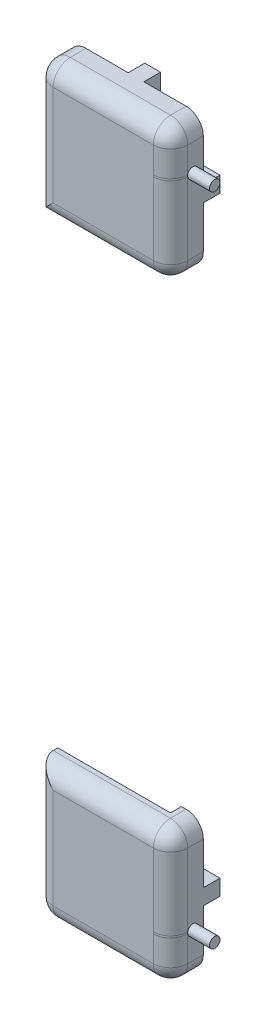
from build123d import *

# Parameters (mm, degrees)
SKETCH6_W              = 32.730904613
SKETCH6_H              = 32.73
LID_EXTRUSION_DEPTH    = 6.35
LEG_EXTRUSION_DEPTH    = 9.53
SKETCH8_W              = 4.572
SKETCH8_H              = 6.35
LOCKING_PIN_DEPTH      = 4.826
SKETCH9_R              = 1.524
LOCKING_CYLINDER_DEPTH = 6.35
FILLET2_R              = 5
FILLET3_R              = 5


# Read off the part's stored shape, not the designer's step: Leg Extrusion
with BuildPart() as part:
    # Sketch6 → Lid Extrusion (new body)
    with BuildSketch(Plane.XY.offset(83.495959084)):
        with Locations((-144.040218944, -497.625165889)):
            Rectangle(SKETCH6_W, SKETCH6_H)
    extrude(amount=LID_EXTRUSION_DEPTH)

    # Leg Extrusion outline → Leg Extrusion (add)
    with BuildSketch(Plane.XY.offset(80.315959084)):
        with BuildLine():
            Line((-160.405671251, -513.990165889), (-160.405671251, -520.340165889))
            Line((-160.405671251, -520.340165889), (-121.324766638, -520.340165889))
            Line((-121.324766638, -520.340165889), (-121.324766638, -486.260165889))
            ThreePointArc((-121.324766638, -486.260165889), (-122.789232732, -482.724631983), (-126.324766638, -481.260165889))
            Line((-126.324766638, -481.260165889), (-127.674766638, -481.260165889))
            Line((-127.674766638, -481.260165889), (-127.674766638, -513.990165889))
            Line((-127.674766638, -513.990165889), (-160.405671251, -513.990165889))
        make_face()
    extrude(amount=LEG_EXTRUSION_DEPTH)

    # Sketch8 → Locking Pin (add)
    with BuildSketch(Plane(origin=(0, 0, 80.315959084), x_dir=(-1, 0, 0), z_dir=(0, 0, -1))):
        with Locations((140.865218944, -517.165165889)):
            Rectangle(SKETCH8_W, SKETCH8_H)
    locking_pin = extrude(amount=LOCKING_PIN_DEPTH)

    # Sketch9 → Locking cylinder (add)
    with BuildSketch(Plane(origin=(-121.324766638, 0, 0), x_dir=(0, 0, -1), z_dir=(1, 0, 0))):
        with Locations(Location((-83.345959084, -507.582855381, 0), (0, 0, 90))):
            Circle(SKETCH9_R)
    extrude(amount=LOCKING_CYLINDER_DEPTH)

    # locking pin mirror: Locking Pin across plane
    add(locking_pin.mirror(Plane(origin=(-320.832466263, -320.832466263, 0), x_dir=(0, 0, 1), z_dir=(-0.7071067811865475, -0.7071067811865477, 0))))


with BuildPart() as body_2:
    # Top mirror: mirrored copy
    add(part.part.mirror(Plane(origin=(0, -412.390165889, 0), x_dir=(0, 0, 1), z_dir=(0, -1, 0))))

    # Fillet2
    fillet2_edges = [body_2.edges().sort_by_distance(p)[0] for p in [
        (-160.405671251, -327.155165889, 89.845959084),
        (-140.865218944, -304.440165889, 89.845959084),
        (-160.405671251, -304.440165889, 85.080959084),
        (-121.324766638, -304.440165889, 85.080959084),
        (-122.789232732, -342.055699795, 89.845959084),
        (-144.040218944, -343.520165889, 89.845959084),
        (-121.324766638, -321.480165889, 89.845959084),
    ]]
    fillet(fillet2_edges, radius=FILLET2_R)


with BuildPart() as part_1:
    add(part.part)

    # Fillet3
    fillet3_edges = [part_1.edges().sort_by_distance(p)[0] for p in [
        (-160.405671251, -497.625165889, 89.845959084),
        (-140.865218944, -520.340165889, 89.845959084),
        (-160.405671251, -520.340165889, 85.080959084),
        (-121.324766638, -520.340165889, 85.080959084),
        (-122.789232732, -482.724631983, 89.845959084),
        (-144.040218944, -481.260165889, 89.845959084),
        (-121.324766638, -503.300165889, 89.845959084),
    ]]
    fillet(fillet3_edges, radius=FILLET3_R)


solid = Compound([body_2.part, part_1.part])
